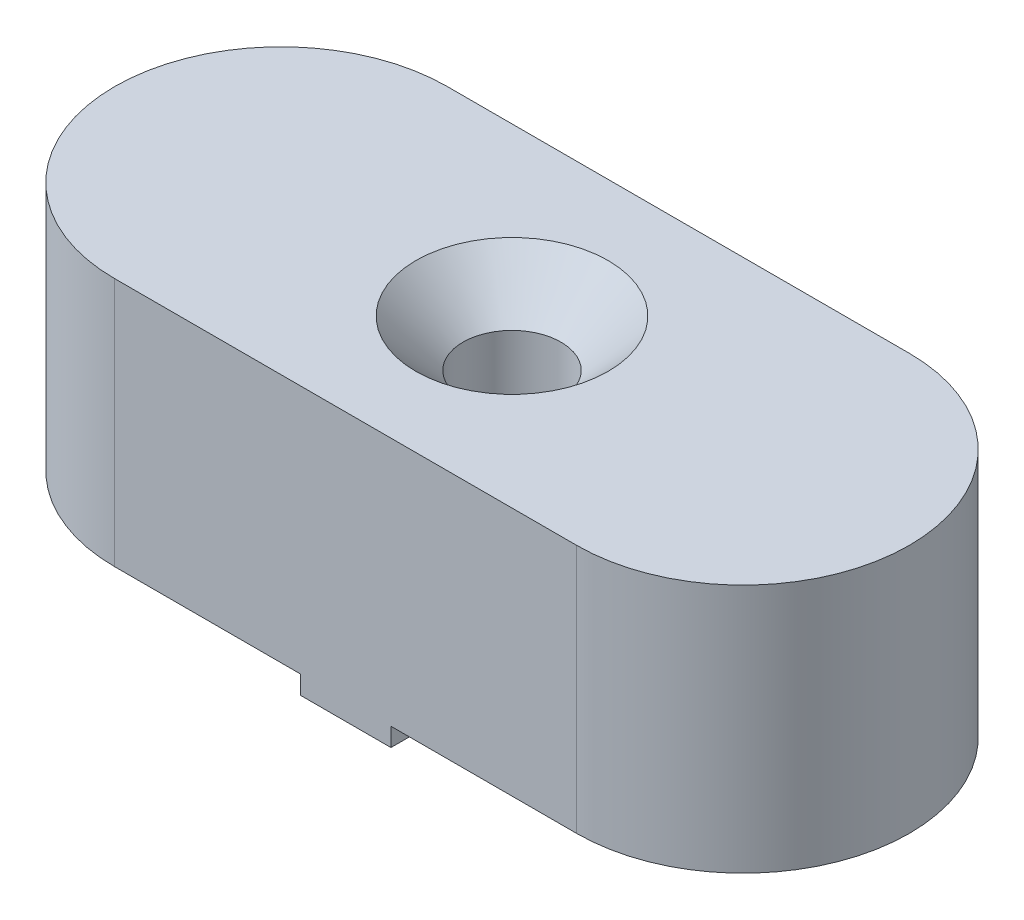
from build123d import *

# Parameters (mm, degrees)
SKETCH1_W                                       = 2.45
SKETCH1_H                                       = 9
BOSS_EXTRUDE1_DEPTH                             = 13.5
BOSS_EXTRUDE2_DEPTH                             = 0.6
BOSS_EXTRUDE3_START                             = -13.5
SKETCH1_4_W                                     = 2.45
SKETCH1_4_H                                     = 9
BOSS_EXTRUDE3_DEPTH                             = 1
MIRROR1_START                                   = -13.5
MIRROR1_OUTLINE_R                               = 6.25
MIRROR1_DEPTH                                   = 13.5
MIRROR1_START_2                                 = -0.6
MIRROR1_2_OUTLINE_R                             = 6.25
MIRROR1_2_DEPTH                                 = 0.6
MIRROR1_START_3                                 = -14.5
MIRROR1_3_DEPTH                                 = 1
CSK_FOR_M5_FLAT_HEAD_MACHINE_SCREW1_D           = 5.3
CSK_FOR_M5_FLAT_HEAD_MACHINE_SCREW1_CSINK_D     = 10.4
CSK_FOR_M5_FLAT_HEAD_MACHINE_SCREW1_CSINK_ANGLE = 90


# Read off the part's stored shape, not the designer's step: Mirror1
with BuildPart() as part:
    # Sketch1 → Boss-Extrude1 (new body)
    with BuildSketch(Plane(origin=(0, 0, 0), x_dir=(1, 0, 0), z_dir=(0, 1, 0))):
        with Locations((1.225, 4.5)):
            Rectangle(SKETCH1_W, SKETCH1_H)
        with BuildLine():
            Line((2.45, 9), (2.45, 0))
            Line((2.45, 0), (6.25, 0))
            ThreePointArc((6.25, 0), (12.5, 6.25), (18.75, 0))
            Line((18.75, 0), (21.5, 0))
            ThreePointArc((21.5, 0), (18.863961031, 6.363961031), (12.5, 9))
            Line((12.5, 9), (2.45, 9))
        make_face()
    extrude(amount=-BOSS_EXTRUDE1_DEPTH)

    # Sketch1<3> → Boss-Extrude2 (add)
    with BuildSketch(Plane(origin=(0, 0, 0), x_dir=(1, 0, 0), z_dir=(0, 1, 0))):
        with BuildLine():
            ThreePointArc((18.75, 0), (12.5, 6.25), (6.25, 0))
            Line((6.25, 0), (18.75, 0))
        make_face()
    extrude(amount=-BOSS_EXTRUDE2_DEPTH)

    # Sketch1<4> → Boss-Extrude3 (add)
    with BuildSketch(Plane(origin=(0, 0, 0), x_dir=(1, 0, 0), z_dir=(0, 1, 0)).offset(BOSS_EXTRUDE3_START)):
        with Locations((1.225, 4.5)):
            Rectangle(SKETCH1_4_W, SKETCH1_4_H)
    extrude(amount=-BOSS_EXTRUDE3_DEPTH)

    # Mirror1 outline → Mirror1 (add)
    with BuildSketch(Plane(origin=(0, 0, 0), x_dir=(1, 0, 0), z_dir=(0, 1, 0)).offset(MIRROR1_START)):
        with BuildLine():
            Line((21.5, 0), (18.75, 0))
            ThreePointArc((18.75, 0), (12.5, -6.25), (6.25, 0))
            Line((6.25, 0), (0, 0))
            Line((0, 0), (0, 9))
            Line((0, 9), (-12.5, 9))
            ThreePointArc((-12.5, 9), (-21.5, 0), (-12.5, -9))
            Line((-12.5, -9), (12.5, -9))
            ThreePointArc((12.5, -9), (18.863961031, -6.363961031), (21.5, 0))
        make_face()
        with Locations((-12.5, 0)):
            Circle(MIRROR1_OUTLINE_R, mode=Mode.SUBTRACT)
    extrude(amount=MIRROR1_DEPTH)

    # Mirror1 2 outline → Mirror1 2 (add)
    with BuildSketch(Plane(origin=(0, 0, 0), x_dir=(1, 0, 0), z_dir=(0, 1, 0)).offset(MIRROR1_START_2)):
        with BuildLine():
            ThreePointArc((6.25, 0), (12.5, -6.25), (18.75, 0))
            Line((18.75, 0), (6.25, 0))
        make_face()
        with Locations((-12.5, 0)):
            Circle(MIRROR1_2_OUTLINE_R)
    extrude(amount=MIRROR1_2_DEPTH)

    # Mirror1 3 outline → Mirror1 3 (add)
    with BuildSketch(Plane(origin=(0, 0, 0), x_dir=(1, 0, 0), z_dir=(0, 1, 0)).offset(MIRROR1_START_3)):
        Polygon((2.45, -9), (2.45, 0), (0, 0), (0, 9), (-2.45, 9), (-2.45, -9), align=None)
    extrude(amount=MIRROR1_3_DEPTH)

    # CSK for M5 Flat Head Machine Screw1 (through all)
    with Locations(Plane(origin=(0, 0, 0), x_dir=(1, 0, 0), z_dir=(0, 1, 0))):
        with Locations((0, 0)):
            CounterSinkHole(CSK_FOR_M5_FLAT_HEAD_MACHINE_SCREW1_D / 2, CSK_FOR_M5_FLAT_HEAD_MACHINE_SCREW1_CSINK_D / 2, counter_sink_angle=CSK_FOR_M5_FLAT_HEAD_MACHINE_SCREW1_CSINK_ANGLE)


solid = part.part
